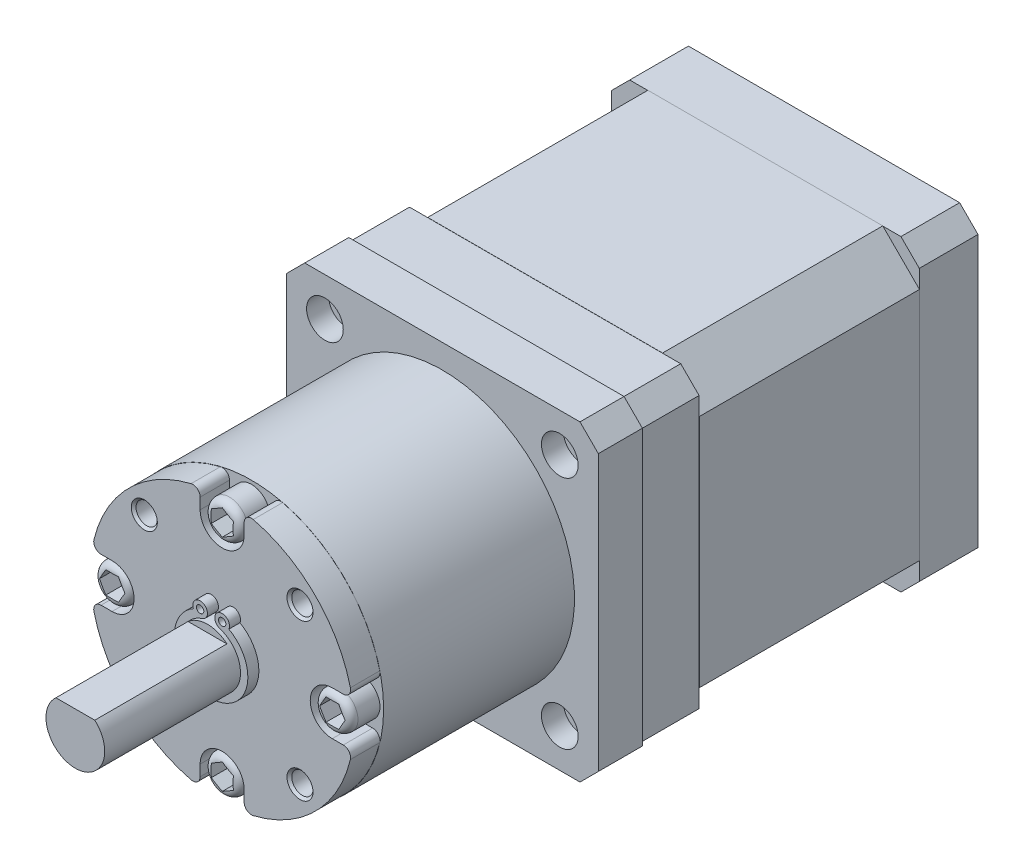
from build123d import *

# Parameters (mm, degrees)
SKETCH1_W                     = 42
SKETCH1_H                     = 42
BOSS_EXTRUDE1_DEPTH           = 30
CHAMFER1_SIZE                 = 5
SKETCH2_W                     = 41.95
SKETCH2_H                     = 41.95
BOSS_EXTRUDE2_DEPTH           = 8
SKETCH3_R                     = 18
BOSS_EXTRUDE3_DEPTH           = 32
SKETCH4_R                     = 2
CUT_EXTRUDE1_DEPTH            = 1
SKETCH5_W                     = 0.5
SKETCH5_H                     = 1.25
SKETCH5_W_2                   = 1.25
SKETCH5_H_2                   = 0.5
CUT_EXTRUDE2_DEPTH            = 2
BOSS_EXTRUDE4_DEPTH           = 4
FILLET2_R                     = 1
SKETCH11_R                    = 4
BOSS_EXTRUDE5_DEPTH           = 20
CUT_EXTRUDE3_START            = -18
CUT_EXTRUDE3_DEPTH            = 18
SKETCH13_W                    = 42.5
SKETCH13_H                    = 42.5
BOSS_EXTRUDE6_DEPTH           = 6
M3_5_TAPPED_HOLE4_D           = 2.9
M3_5_TAPPED_HOLE4_DEPTH       = 5.8
M3_5_TAPPED_HOLE4_CSINK_D     = 3.55
M3_5_TAPPED_HOLE4_CSINK_ANGLE = 90
M3_5_TAPPED_HOLE4_TIP         = 0.871247898
SKETCH19_R                    = 2.5
BOSS_EXTRUDE7_DEPTH           = 4
FILLET4_R                     = 1
SKETCH20_R                    = 0.5
BOSS_EXTRUDE8_DEPTH           = 1.5
SKETCH21_W                    = 9
SKETCH21_H                    = 3
SKETCH21_W_2                  = 6
SKETCH21_H_2                  = 2
BOSS_EXTRUDE9_DEPTH           = 1
SKETCH22_R                    = 0.5
BOSS_EXTRUDE10_DEPTH          = 5
SKETCH23_R                    = 0.5
BOSS_EXTRUDE11_DEPTH          = 5
BOSS_EXTRUDE11_2_DEPTH        = 5
BOSS_EXTRUDE11_3_DEPTH        = 5
BOSS_EXTRUDE11_4_DEPTH        = 5
CHAMFER4_SIZE                 = 2.5
SKETCH24_R                    = 2.5
CUT_EXTRUDE4_DEPTH            = 3
SKETCH25_W                    = 1
SKETCH25_H                    = 1.5
SKETCH25_H_2                  = 1
SKETCH25_W_2                  = 1.5
CUT_EXTRUDE5_DEPTH            = 2


# Read off the part's stored shape, not the designer's step: Boss-Extrude4
with BuildPart() as part:
    # Sketch1 → Boss-Extrude1 (new body)
    with BuildSketch(Plane.XY):
        Rectangle(SKETCH1_W, SKETCH1_H)
    extrude(amount=BOSS_EXTRUDE1_DEPTH)

    # Chamfer1
    chamfer1_edges = [part.edges().sort_by_distance(p)[0] for p in [
        (21, -21, 15),
        (-21, -21, 15),
        (-21, 21, 15),
        (21, 21, 15),
    ]]
    chamfer(chamfer1_edges, length=CHAMFER1_SIZE)

    # Sketch2 → Boss-Extrude2 (add)
    with BuildSketch(Plane.XY.offset(30)):
        Rectangle(SKETCH2_W, SKETCH2_H)
    boss_extrude2 = extrude(amount=BOSS_EXTRUDE2_DEPTH)

    # Mirror1: Boss-Extrude2 across plane
    add(boss_extrude2.mirror(Plane.XY.offset(15)))

    # Sketch3 → Boss-Extrude3 (add)
    with BuildSketch(Plane.XY.offset(38)):
        Circle(SKETCH3_R)
    extrude(amount=BOSS_EXTRUDE3_DEPTH)

    # Sketch4 → Cut-Extrude1 (cut)
    with BuildSketch(Plane(origin=(0, 0, -8), x_dir=(-1, 0, 0), z_dir=(0, 0, -1))):
        with Locations((16, 16)):
            Circle(SKETCH4_R)
        with Locations((16, -16)):
            Circle(SKETCH4_R)
        with Locations((-16, -16)):
            Circle(SKETCH4_R)
        with Locations((-16, 16)):
            Circle(SKETCH4_R)
    extrude(amount=-CUT_EXTRUDE1_DEPTH, mode=Mode.SUBTRACT)

    # Sketch5 → Cut-Extrude2 (cut)
    with BuildSketch(Plane(origin=(0, 0, -7), x_dir=(-1, 0, 0), z_dir=(0, 0, -1))):
        with Locations((16, 16.875)):
            Rectangle(SKETCH5_W, SKETCH5_H)
        with Locations((15.125, 16)):
            Rectangle(SKETCH5_W_2, SKETCH5_H_2)
        with Locations((16, 16)):
            Rectangle(SKETCH5_W, SKETCH5_H_2)
        with Locations((16, 15.125)):
            Rectangle(SKETCH5_W, SKETCH5_H)
        with Locations((16.875, 16)):
            Rectangle(SKETCH5_W_2, SKETCH5_H_2)
        with Locations((-16, 16.875)):
            Rectangle(SKETCH5_W, SKETCH5_H)
        with Locations((-16, 16)):
            Rectangle(SKETCH5_W, SKETCH5_H_2)
        with Locations((-16.875, 16)):
            Rectangle(SKETCH5_W_2, SKETCH5_H_2)
        with Locations((-15.125, 16)):
            Rectangle(SKETCH5_W_2, SKETCH5_H_2)
        with Locations((-16, 15.125)):
            Rectangle(SKETCH5_W, SKETCH5_H)
        with Locations((-16, -15.125)):
            Rectangle(SKETCH5_W, SKETCH5_H)
        with Locations((-16, -16)):
            Rectangle(SKETCH5_W, SKETCH5_H_2)
        with Locations((-16, -16.875)):
            Rectangle(SKETCH5_W, SKETCH5_H)
        with Locations((-16.875, -16)):
            Rectangle(SKETCH5_W_2, SKETCH5_H_2)
        with Locations((-15.125, -16)):
            Rectangle(SKETCH5_W_2, SKETCH5_H_2)
        with Locations((16, -15.125)):
            Rectangle(SKETCH5_W, SKETCH5_H)
        with Locations((16, -16)):
            Rectangle(SKETCH5_W, SKETCH5_H_2)
        with Locations((16, -16.875)):
            Rectangle(SKETCH5_W, SKETCH5_H)
        with Locations((16.875, -16)):
            Rectangle(SKETCH5_W_2, SKETCH5_H_2)
        with Locations((15.125, -16)):
            Rectangle(SKETCH5_W_2, SKETCH5_H_2)
    extrude(amount=-CUT_EXTRUDE2_DEPTH, mode=Mode.SUBTRACT)

    # Boss-Extrude4 outline → Boss-Extrude4 (add)
    with BuildSketch(Plane.XY.offset(70)):
        with BuildLine():
            Line((-17.722884218, 3), (-15, 3))
            ThreePointArc((-15, 3), (-12, 0), (-15, -3))
            Line((-15, -3), (-17.722884218, -3))
            ThreePointArc((-17.722884218, -3), (-12.710244392, -12.710244392), (-3, -17.722884218))
            Line((-3, -17.722884218), (-3, -15))
            ThreePointArc((-3, -15), (0, -12), (3, -15))
            Line((3, -15), (3, -17.722884218))
            ThreePointArc((3, -17.722884218), (12.710244392, -12.710244392), (17.722884218, -3))
            Line((17.722884218, -3), (15, -3))
            ThreePointArc((15, -3), (12, 0), (15, 3))
            Line((15, 3), (17.722884218, 3))
            ThreePointArc((17.722884218, 3), (12.710244392, 12.710244392), (3, 17.722884218))
            Line((3, 17.722884218), (3, 15))
            ThreePointArc((3, 15), (0, 12), (-3, 15))
            Line((-3, 15), (-3, 17.722884218))
            ThreePointArc((-3, 17.722884218), (-12.710244392, 12.710244392), (-17.722884218, 3))
        make_face()
    extrude(amount=BOSS_EXTRUDE4_DEPTH)

    # Fillet2
    fillet2_edges = [part.edges().sort_by_distance(p)[0] for p in [
        (-17.722884218, -3, 72),
        (-3, -17.722884218, 72),
        (3, -17.722884218, 72),
        (17.722884218, -3, 72),
        (17.722884218, 3, 72),
        (3, 17.722884218, 72),
        (-3, 17.722884218, 72),
        (-17.722884218, 3, 72),
    ]]
    fillet(fillet2_edges, radius=FILLET2_R)

    # Sketch11 → Boss-Extrude5 (add)
    with BuildSketch(Plane.XY.offset(74)):
        Circle(SKETCH11_R)
    extrude(amount=BOSS_EXTRUDE5_DEPTH)

    # Sketch12 → Cut-Extrude3 (cut)
    with BuildSketch(Plane.XY.offset(94).offset(CUT_EXTRUDE3_START)):
        with BuildLine():
            Line((-2.645751311, 3), (2.645751311, 3))
            ThreePointArc((2.645751311, 3), (0, 4), (-2.645751311, 3))
        make_face()
    extrude(amount=CUT_EXTRUDE3_DEPTH, mode=Mode.SUBTRACT)

    # Sketch13 → Boss-Extrude6 (add)
    with BuildSketch(Plane.XY.offset(38)):
        Rectangle(SKETCH13_W, SKETCH13_H)
    extrude(amount=BOSS_EXTRUDE6_DEPTH)

    # M3.5 Tapped Hole4
    with Locations(Plane.XY.offset(74)):
        with Locations((-10.606601718, 10.606601718), (10.606601718, 10.606601718), (10.606601718, -10.606601718), (-10.606601718, -10.606601718)):
            CounterSinkHole(M3_5_TAPPED_HOLE4_D / 2, M3_5_TAPPED_HOLE4_CSINK_D / 2, depth=M3_5_TAPPED_HOLE4_DEPTH, counter_sink_angle=M3_5_TAPPED_HOLE4_CSINK_ANGLE)
            with Locations((0, 0, -(M3_5_TAPPED_HOLE4_DEPTH + M3_5_TAPPED_HOLE4_TIP / 2))):  # 118° drill point
                Cone(0, M3_5_TAPPED_HOLE4_D / 2, M3_5_TAPPED_HOLE4_TIP, mode=Mode.SUBTRACT)

    # Sketch19 → Boss-Extrude7 (add)
    # profile 1 of 4: a face of its own
    with BuildSketch(Plane.XY.offset(70)):
        with Locations((0, 15)):
            Circle(SKETCH19_R)
        Polygon((0, 16.732050808), (-1.5, 15.866025404), (-1.5, 14.133974596), (0, 13.267949192), (1.5, 14.133974596), (1.5, 15.866025404), align=None, mode=Mode.SUBTRACT)
    # profile 2 of 4: a face of its own
    with BuildSketch(Plane.XY.offset(70)):
        with Locations((15, 0)):
            Circle(SKETCH19_R)
        Polygon((16.732050808, 0), (15.866025404, 1.5), (14.133974596, 1.5), (13.267949192, 0), (14.133974596, -1.5), (15.866025404, -1.5), align=None, mode=Mode.SUBTRACT)
    # profile 3 of 4: a face of its own
    with BuildSketch(Plane.XY.offset(70)):
        with Locations((0, -15)):
            Circle(SKETCH19_R)
        Polygon((0, -16.732050808), (1.5, -15.866025404), (1.5, -14.133974596), (0, -13.267949192), (-1.5, -14.133974596), (-1.5, -15.866025404), align=None, mode=Mode.SUBTRACT)
    # profile 4 of 4: a face of its own
    with BuildSketch(Plane.XY.offset(70)):
        with Locations((-15, 0)):
            Circle(SKETCH19_R)
        Polygon((-16.732050808, 0), (-15.866025404, -1.5), (-14.133974596, -1.5), (-13.267949192, 0), (-14.133974596, 1.5), (-15.866025404, 1.5), align=None, mode=Mode.SUBTRACT)
    extrude(amount=BOSS_EXTRUDE7_DEPTH)

    # Fillet4
    # the kernel refuses this fillet: 1 mm, written as the material it takes off along each edge
    with BuildSketch(Plane(origin=(0, -15, 74), x_dir=(1, 0, 0), z_dir=(0, -1, 0))) as fillet4_piece_1:
        with BuildLine():
            CenterArc((2.5 - FILLET4_R, -FILLET4_R), FILLET4_R, 0, 90)
            Line((2.5 - FILLET4_R, 0), (2.5, 0))
            Line((2.5, 0), (2.5, -FILLET4_R))
        make_face()
    revolve(axis=Axis((0, -15, 74), (0, 0, 1)), mode=Mode.SUBTRACT)
    with BuildSketch(Plane(origin=(-15, 0, 74), x_dir=(1, 0, 0), z_dir=(0, -1, 0))) as fillet4_piece_2:
        with BuildLine():
            CenterArc((2.5 - FILLET4_R, -FILLET4_R), FILLET4_R, 0, 90)
            Line((2.5 - FILLET4_R, 0), (2.5, 0))
            Line((2.5, 0), (2.5, -FILLET4_R))
        make_face()
    revolve(axis=Axis((-15, 0, 74), (0, 0, 1)), mode=Mode.SUBTRACT)
    with BuildSketch(Plane(origin=(15, 0, 74), x_dir=(1, 0, 0), z_dir=(0, -1, 0))) as fillet4_piece_3:
        with BuildLine():
            CenterArc((2.5 - FILLET4_R, -FILLET4_R), FILLET4_R, 0, 90)
            Line((2.5 - FILLET4_R, 0), (2.5, 0))
            Line((2.5, 0), (2.5, -FILLET4_R))
        make_face()
    revolve(axis=Axis((15, 0, 74), (0, 0, 1)), mode=Mode.SUBTRACT)
    with BuildSketch(Plane(origin=(0, 15, 74), x_dir=(1, 0, 0), z_dir=(0, -1, 0))) as fillet4_piece_4:
        with BuildLine():
            CenterArc((2.5 - FILLET4_R, -FILLET4_R), FILLET4_R, 0, 90)
            Line((2.5 - FILLET4_R, 0), (2.5, 0))
            Line((2.5, 0), (2.5, -FILLET4_R))
        make_face()
    revolve(axis=Axis((0, 15, 74), (0, 0, 1)), mode=Mode.SUBTRACT)

    # Sketch20 → Boss-Extrude8 (add)
    with BuildSketch(Plane.XY.offset(74)):
        with BuildLine():
            ThreePointArc((-1.2, 3.815756806), (0, -4), (1.2, 3.815756806))
            ThreePointArc((1.2, 3.815756806), (1.082564084, 5.678402371), (2.419157521, 4.375805856))
            ThreePointArc((2.419157521, 4.375805856), (0, -5), (-2.419157521, 4.375805856))
            ThreePointArc((-2.419157521, 4.375805856), (-1.082564084, 5.678402371), (-1.2, 3.815756806))
        make_face()
        with Locations((1.5, 4.769696007)):
            Circle(SKETCH20_R, mode=Mode.SUBTRACT)
        with Locations((-1.5, 4.769696007)):
            Circle(SKETCH20_R, mode=Mode.SUBTRACT)
    extrude(amount=BOSS_EXTRUDE8_DEPTH)

    # Chamfer4
    chamfer4_edges = [part.edges().sort_by_distance(p)[0] for p in [
        (21.25, -21.25, 41),
        (21.25, 21.25, 41),
        (-21.25, 21.25, 41),
        (-21.25, -21.25, 41),
        (20.975, -20.975, 34),
        (20.975, 20.975, 34),
        (-20.975, 20.975, 34),
        (-20.975, -20.975, 34),
        (20.975, 20.975, -4),
        (20.975, -20.975, -4),
        (-20.975, -20.975, -4),
        (-20.975, 20.975, -4),
    ]]
    chamfer(chamfer4_edges, length=CHAMFER4_SIZE)

    # Sketch24 → Cut-Extrude4 (cut)
    with BuildSketch(Plane.XY.offset(44)):
        with Locations((-16, 16)):
            Circle(SKETCH24_R)
        with Locations((16, 16)):
            Circle(SKETCH24_R)
        with Locations((16, -16)):
            Circle(SKETCH24_R)
        with Locations((-16, -16)):
            Circle(SKETCH24_R)
    extrude(amount=-CUT_EXTRUDE4_DEPTH, mode=Mode.SUBTRACT)

    # Sketch25 → Cut-Extrude5 (cut)
    with BuildSketch(Plane.XY.offset(41)):
        with Locations((-16, 17.25)):
            Rectangle(SKETCH25_W, SKETCH25_H)
        with Locations((-16, 16)):
            Rectangle(SKETCH25_W, SKETCH25_H_2)
        with Locations((-17.25, 16)):
            Rectangle(SKETCH25_W_2, SKETCH25_H_2)
        with Locations((-14.75, 16)):
            Rectangle(SKETCH25_W_2, SKETCH25_H_2)
        with Locations((-16, 14.75)):
            Rectangle(SKETCH25_W, SKETCH25_H)
        with Locations((16, 17.25)):
            Rectangle(SKETCH25_W, SKETCH25_H)
        with Locations((14.75, 16)):
            Rectangle(SKETCH25_W_2, SKETCH25_H_2)
        with Locations((16, 16)):
            Rectangle(SKETCH25_W, SKETCH25_H_2)
        with Locations((17.25, 16)):
            Rectangle(SKETCH25_W_2, SKETCH25_H_2)
        with Locations((16, 14.75)):
            Rectangle(SKETCH25_W, SKETCH25_H)
        with Locations((16, -14.75)):
            Rectangle(SKETCH25_W, SKETCH25_H)
        with Locations((16, -16)):
            Rectangle(SKETCH25_W, SKETCH25_H_2)
        with Locations((17.25, -16)):
            Rectangle(SKETCH25_W_2, SKETCH25_H_2)
        with Locations((14.75, -16)):
            Rectangle(SKETCH25_W_2, SKETCH25_H_2)
        with Locations((16, -17.25)):
            Rectangle(SKETCH25_W, SKETCH25_H)
        with Locations((-16, -14.75)):
            Rectangle(SKETCH25_W, SKETCH25_H)
        with Locations((-16, -16)):
            Rectangle(SKETCH25_W, SKETCH25_H_2)
        with Locations((-14.75, -16)):
            Rectangle(SKETCH25_W_2, SKETCH25_H_2)
        with Locations((-17.25, -16)):
            Rectangle(SKETCH25_W_2, SKETCH25_H_2)
        with Locations((-16, -17.25)):
            Rectangle(SKETCH25_W, SKETCH25_H)
    extrude(amount=-CUT_EXTRUDE5_DEPTH, mode=Mode.SUBTRACT)


with BuildPart() as body_2:
    # Sketch21 → Boss-Extrude9 (new body)
    with BuildSketch(Plane.XZ.offset(21)):
        with Locations((0, -4)):
            Rectangle(SKETCH21_W, SKETCH21_H)
        with Locations((0, -4)):
            Rectangle(SKETCH21_W_2, SKETCH21_H_2, mode=Mode.SUBTRACT)
    extrude(amount=BOSS_EXTRUDE9_DEPTH)


with BuildPart() as body_3:
    # Sketch22 → Boss-Extrude10 (new body)
    with BuildSketch(Plane.XZ.offset(21)):
        with Locations(Location((2.3, -4, 0), (0, 0, 270))):
            Circle(SKETCH22_R)
    extrude(amount=BOSS_EXTRUDE10_DEPTH)


with BuildPart() as body_4:
    # Sketch23 → Boss-Extrude11 (new body)
    with BuildSketch(Plane.XZ.offset(21)):
        with Locations(Location((0.7, -4, 0), (0, 0, 270))):
            Circle(SKETCH23_R)
    extrude(amount=BOSS_EXTRUDE11_DEPTH)


with BuildPart() as body_5:
    # Sketch23 → Boss-Extrude11 2 (new body)
    with BuildSketch(Plane.XZ.offset(21)):
        with Locations(Location((2.3, -4, 0), (0, 0, 270))):
            Circle(SKETCH23_R)
    extrude(amount=BOSS_EXTRUDE11_2_DEPTH)


with BuildPart() as body_6:
    # Sketch23 → Boss-Extrude11 3 (new body)
    with BuildSketch(Plane.XZ.offset(21)):
        with Locations(Location((-2.3, -4, 0), (0, 0, 90))):
            Circle(SKETCH23_R)
    extrude(amount=BOSS_EXTRUDE11_3_DEPTH)


with BuildPart() as body_7:
    # Sketch23 → Boss-Extrude11 4 (new body)
    with BuildSketch(Plane.XZ.offset(21)):
        with Locations(Location((-0.7, -4, 0), (0, 0, 90))):
            Circle(SKETCH23_R)
    extrude(amount=BOSS_EXTRUDE11_4_DEPTH)


solid = Compound([part.part, body_2.part, body_3.part, body_4.part, body_5.part, body_6.part, body_7.part])
